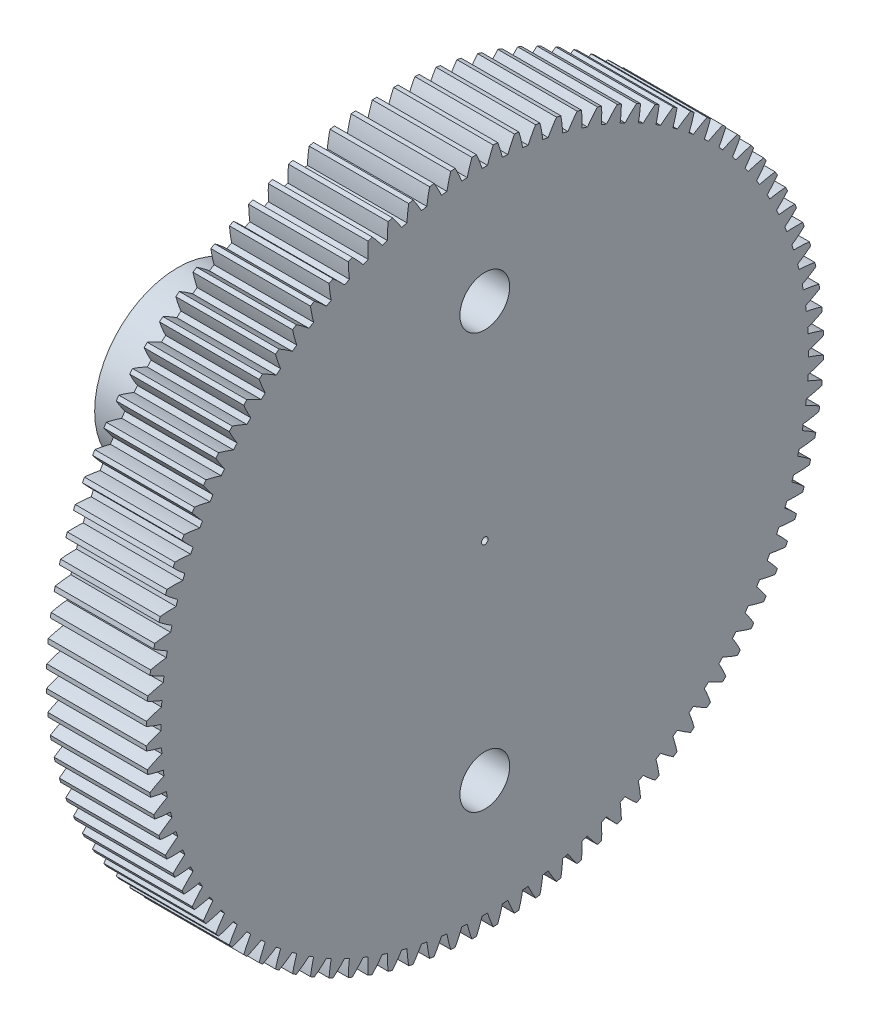
from build123d import *

# Parameters (mm, degrees)
BASPROSKE_W         = 12
BASPROSKE_H         = 40.8
TOOTHCUT_DEPTH      = 59.934539957
TEETHCUTS_COUNT     = 100
TEETHCUTS_ANGLE     = 356.4
BORSKE_R            = 0.4
BORE_DEPTH          = 50.0001016
SKETCH1_R           = 3
CUT_EXTRUDE1_DEPTH  = 20
HUBNEAONESKE_R      = 10
BOSS_EXTRUDE1_DEPTH = 25
SKETCH2_R           = 1
CUT_EXTRUDE2_DEPTH  = 10


with BuildPart() as part:
    # BasProSke → Base-Revolve (revolve)
    with BuildSketch(Plane(origin=(0, 0, 0), x_dir=(1, 0, 0), z_dir=(0, 1, 0))):
        with Locations((6, 20.4)):
            Rectangle(BASPROSKE_W, BASPROSKE_H)
    revolve(axis=Axis((-10, 0, 0), (1, 0, 0)))

    # TooCutSke → ToothCut (cut, through all)
    with BuildSketch(Plane(origin=(0, 0, 0), x_dir=(0, 0, -1), z_dir=(1, 0, 0))):
        with BuildLine():
            ThreePointArc((0.330999362, 38.997595316), (0, 38.999), (-0.330999362, 38.997595316))
            ThreePointArc((-0.330999362, 38.997595316), (-0.650493595, 39.915608602), (-1.025143027, 40.812527083))
            ThreePointArc((-1.025143027, 40.812527083), (0, 40.8254), (1.025143027, 40.812527083))
            ThreePointArc((1.025143027, 40.812527083), (0.650493595, 39.915608602), (0.330999362, 38.997595316))
        make_face()
    toothcut = extrude(amount=TOOTHCUT_DEPTH, mode=Mode.SUBTRACT)

    # TeethCuts: ToothCut ×100 about axis
    teethcuts_axis = Axis((-10, 0, 0), (1, 0, 0))
    for i in range(1, TEETHCUTS_COUNT):
        add(toothcut.rotate(teethcuts_axis, i * TEETHCUTS_ANGLE / (TEETHCUTS_COUNT - 1)), mode=Mode.SUBTRACT)

    # BorSke → Bore (cut, symmetric)
    with BuildSketch(Plane(origin=(0, 0, 0), x_dir=(0, 0, -1), z_dir=(1, 0, 0))):
        Circle(BORSKE_R)
    extrude(amount=BORE_DEPTH, both=True, mode=Mode.SUBTRACT)

    # Sketch1 → Cut-Extrude1 (cut)
    with BuildSketch(Plane(origin=(12, 0, 0), x_dir=(0, 0, -1), z_dir=(1, 0, 0))):
        with Locations((-5e-05, 25)):
            Circle(SKETCH1_R)
        with Locations((-5e-05, -25)):
            Circle(SKETCH1_R)
    extrude(amount=-CUT_EXTRUDE1_DEPTH, mode=Mode.SUBTRACT)

    # HubNeaOneSke → Boss-Extrude1 (add)
    with BuildSketch(Plane.ZY):
        Circle(HUBNEAONESKE_R)
    extrude(amount=BOSS_EXTRUDE1_DEPTH)

    # Sketch2 → Cut-Extrude2 (cut)
    with BuildSketch(Plane.ZY.offset(25)):
        with Locations((3.847865819, -0.635553802)):
            Circle(SKETCH2_R)
        with Locations((1.373527172, -3.650126451)):
            Circle(SKETCH2_R)
        with Locations((-2.474338648, -3.014572649)):
            Circle(SKETCH2_R)
        with Locations((-3.847865819, 0.635553802)):
            Circle(SKETCH2_R)
        with Locations((-1.373527172, 3.650126451)):
            Circle(SKETCH2_R)
        with Locations((2.474338648, 3.014572649)):
            Circle(SKETCH2_R)
    extrude(amount=-CUT_EXTRUDE2_DEPTH, mode=Mode.SUBTRACT)


solid = part.part
